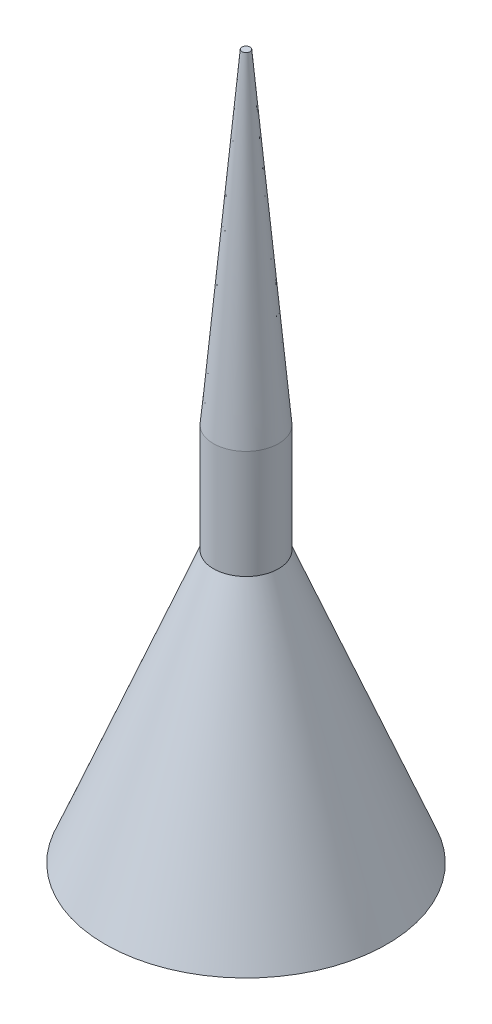
from build123d import *

# Parameters (mm, degrees)
SKETCH1_R           = 6
BOSS_EXTRUDE1_DEPTH = 20
SKETCH2_R           = 26
BOSS_EXTRUDE2_DEPTH = 50
CHAMFER1_SIZE       = 50
CHAMFER1_SIZE_2     = 20
SKETCH3_R           = 6
BOSS_EXTRUDE3_DEPTH = 60
BOSS_EXTRUDE3_TAPER = 5


# Read off the part's stored shape, not the designer's step: Shell1
with BuildPart() as part:
    # Sketch1 → Boss-Extrude1 (new body)
    with BuildSketch(Plane(origin=(0, 0, 0), x_dir=(1, 0, 0), z_dir=(0, 1, 0))):
        with Locations(Location((0, 0, 0), (0, 0, 270))):
            Circle(SKETCH1_R)
    extrude(amount=BOSS_EXTRUDE1_DEPTH)

    # Sketch2 → Boss-Extrude2 (add)
    with BuildSketch(Plane.XZ):
        with Locations(Location((0, 0, 0), (0, 0, 270))):
            Circle(SKETCH2_R)
    extrude(amount=BOSS_EXTRUDE2_DEPTH)

    # Chamfer1
    # the kernel refuses this chamfer: 50, 20 mm, written as the material it takes off along each edge
    with BuildSketch(Plane(origin=(0, 0, 0), x_dir=(0, 0, -1), z_dir=(-1, 0, 0))) as chamfer1_piece_1:
        Polygon((26, CHAMFER1_SIZE), (26 - CHAMFER1_SIZE_2, 0), (26, 0), align=None)
    revolve(axis=Axis((0, 0, 0), (0, -1, 0)), mode=Mode.SUBTRACT)

    # Shell1 outline → Shell1 (revolve, cut)
    with BuildSketch(Plane.XY):
        Polygon((15.229670386, -50), (0, -11.925824036), (0, -50), align=None)
    revolve(axis=Axis((0, 0, 0), (0, 1, 0)), mode=Mode.SUBTRACT)

    # Sketch3 → Boss-Extrude3 (add)
    with BuildSketch(Plane(origin=(0, 20, 0), x_dir=(1, 0, 0), z_dir=(0, 1, 0))):
        with Locations(Location((0, 0, 0), (0, 0, 90))):
            Circle(SKETCH3_R)
    extrude(amount=BOSS_EXTRUDE3_DEPTH, taper=BOSS_EXTRUDE3_TAPER)


solid = part.part
